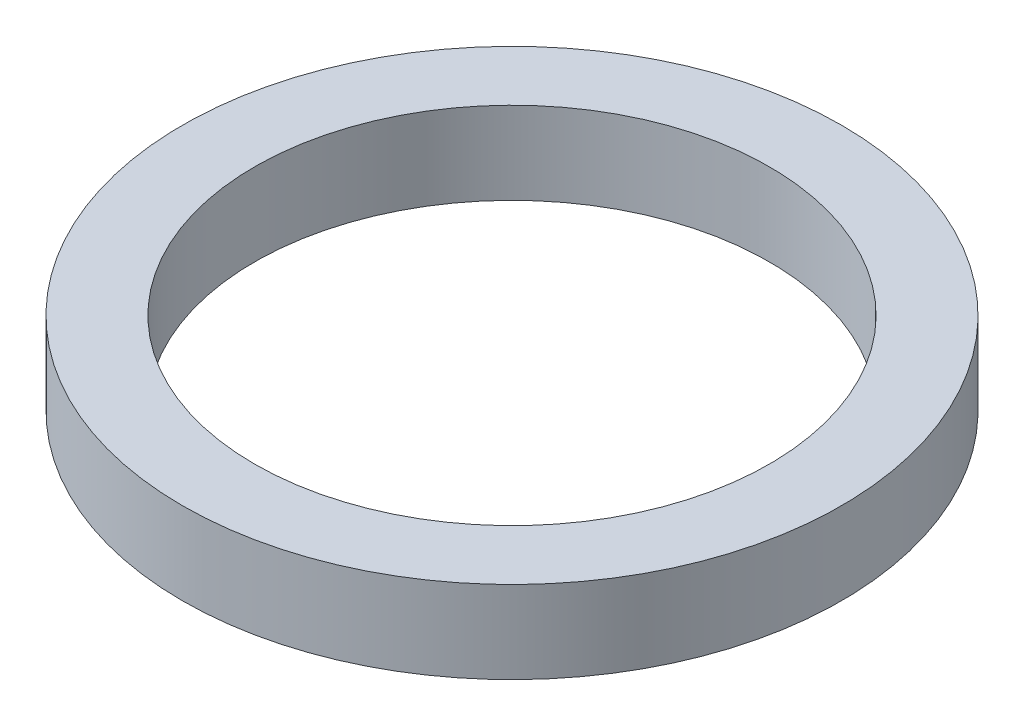
from build123d import *

# Parameters (mm, degrees)
SKETCH1_R           = 16
SKETCH1_R_2         = 12.5
BOSS_EXTRUDE1_DEPTH = 4


with BuildPart() as part:
    # Sketch1 → Boss-Extrude1 (new body)
    with BuildSketch(Plane(origin=(0, 135.1550465, 0), x_dir=(1, 0, 0), z_dir=(0, 1, 0))):
        with Locations((0.5, 0)):
            Circle(SKETCH1_R)
        with Locations((0.5, 0)):
            Circle(SKETCH1_R_2, mode=Mode.SUBTRACT)
    extrude(amount=BOSS_EXTRUDE1_DEPTH)


solid = part.part
